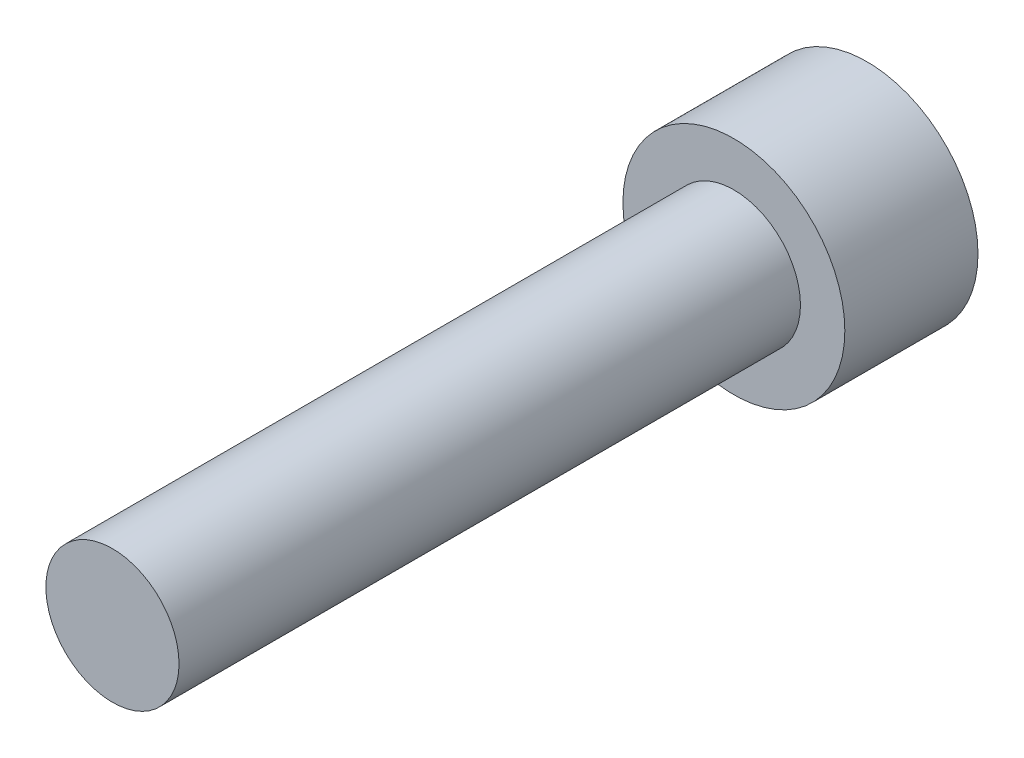
from build123d import *

# Parameters (mm, degrees)
SKETCH_1_R                = 5
EXTRUDE_1_DEPTH           = 6
CUT_EXTRUDE_START         = -3
CUT_EXTRUDE_1_DEPTH       = 3
CUT_EXTRUDE_START_2       = -34
CUT_EXTRUDE_1_2_OUTLINE_R = 3
CUT_EXTRUDE_1_2_DEPTH     = 28


# Read off the part's stored shape, not the designer's step: ｶｯﾄ - 押し出し1
with BuildPart() as part:
    # ｽｹｯﾁ1 → ﾎﾞｽ - 押し出し1 (new body)
    with BuildSketch(Plane.XY):
        Circle(SKETCH_1_R)
    extrude(amount=EXTRUDE_1_DEPTH)

    # ｶｯﾄ - 押し出し1 outline → ｶｯﾄ - 押し出し1 (cut)
    with BuildSketch(Plane(origin=(0, 0, 0), x_dir=(-1, 0, 0), z_dir=(0, 0, -1)).offset(CUT_EXTRUDE_START)):
        Polygon((3.267510606, -0.936315364), (2.444628194, 2.36158951), (-0.822882412, 3.297904873), (-3.267510606, 0.936315364), (-2.444628194, -2.36158951), (0.822882412, -3.297904873), align=None)
    extrude(amount=CUT_EXTRUDE_1_DEPTH, mode=Mode.SUBTRACT)

    # Cut-Extrude 1 2 outline → Cut-Extrude 1 2 (add)
    with BuildSketch(Plane(origin=(0, 0, 0), x_dir=(-1, 0, 0), z_dir=(0, 0, -1)).offset(CUT_EXTRUDE_START_2)):
        Circle(CUT_EXTRUDE_1_2_OUTLINE_R)
    extrude(amount=CUT_EXTRUDE_1_2_DEPTH)


solid = part.part
